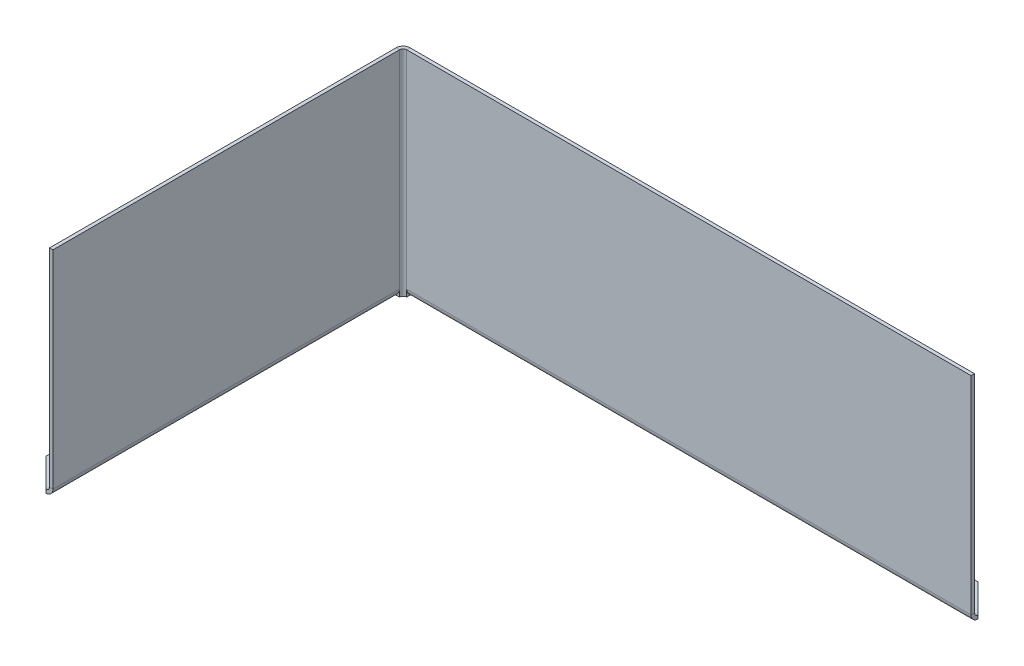
from build123d import *

# Parameters (mm, degrees)
SKETCH1_W                    = 125.73
SKETCH1_H                    = 76.2
BASE_FLANGE1_DEPTH           = 1.2192
EDGE_FLANGE1_STRIP_W         = 7.4168
EDGE_FLANGE1_STRIP_H         = 1.2192
EDGE_FLANGE1_STRIP_CUT_DEPTH = 76.2
EDGE_FLANGE1_DEPTH           = 76.2
EDGE_FLANGE2_STRIP_W         = 7.4168
EDGE_FLANGE2_STRIP_H         = 1.2192
EDGE_FLANGE2_STRIP_CUT_DEPTH = 123.2408
EDGE_FLANGE2_DEPTH           = 123.2408
EDGE_FLANGE3_STRIP_W         = 7.4168
EDGE_FLANGE3_STRIP_H         = 1.2192
EDGE_FLANGE3_STRIP_CUT_DEPTH = 200.7108
EDGE_FLANGE3_DEPTH           = 200.7108
BREAK_CORNER5_START          = -96.12466152
BREAK_CORNER5_OUTLINE_W      = 143.62455456
BREAK_CORNER5_OUTLINE_H      = 4
BREAK_CORNER5_DEPTH          = 7.220125921
BREAK_CORNER5_START_2        = 38.579180296
BREAK_CORNER5_2_OUTLINE_W    = 8.37544544
BREAK_CORNER5_2_OUTLINE_H    = 4
BREAK_CORNER5_2_DEPTH        = 14.440251843
BREAK_CORNER6_START          = -96.12466152
BREAK_CORNER6_OUTLINE_W      = 88.7601302
BREAK_CORNER6_OUTLINE_H      = 4
BREAK_CORNER6_DEPTH          = 7.220125921
BREAK_CORNER6_START_2        = -16.200382042
BREAK_CORNER6_2_OUTLINE_W    = 8.2398698
BREAK_CORNER6_2_OUTLINE_H    = 4
BREAK_CORNER6_2_DEPTH        = 14.440251842


# Read off the part's stored shape, not the designer's step: Break-Corner5, Break-Corner6
# Sheet-metal steps are written as plain solids
with BuildPart() as part:
    # Sketch1 → Base-Flange1 (new body)
    with BuildSketch(Plane(origin=(0, 0, 0), x_dir=(0, 0, -1), z_dir=(1, 0, 0))):
        with Locations((62.865, 38.1)):
            Rectangle(SKETCH1_W, SKETCH1_H)
    extrude(amount=-BASE_FLANGE1_DEPTH)

    # Edge-Flange1 strip (across the edge) → Edge-Flange1 strip cut (cut)
    with BuildSketch(Plane(origin=(0, 0, -125.73), x_dir=(0, 0, 1), z_dir=(0, 1, 0))):
        with Locations((-1.2192, -0.6096)):
            Rectangle(EDGE_FLANGE1_STRIP_W, EDGE_FLANGE1_STRIP_H)
    extrude(amount=EDGE_FLANGE1_STRIP_CUT_DEPTH, mode=Mode.SUBTRACT)

    # Edge-Flange1 section (across the edge) → Edge-Flange1 (add)
    with BuildSketch(Plane(origin=(0, 0, -125.73), x_dir=(0, 0, 1), z_dir=(0, 1, 0))):
        with BuildLine():
            Line((0, 1.27), (0, 201.9808))
            Line((0, 201.9808), (1.2192, 201.9808))
            Line((1.2192, 201.9808), (1.2192, 1.27))
            ThreePointArc((1.2192, 1.27), (1.591174388, 0.371974388), (2.4892, 0))
            Line((2.4892, 0), (2.4892, -1.2192))
            ThreePointArc((2.4892, -1.2192), (0.7290698, -0.4901302), (0, 1.27))
        make_face()
    extrude(amount=EDGE_FLANGE1_DEPTH)

    # Edge-Flange2 strip (across the edge) → Edge-Flange2 strip cut (cut)
    with BuildSketch(Plane(origin=(-1.2192, 0, -123.2408), x_dir=(0, 1, 0), z_dir=(0, 0, 1))):
        with Locations((-1.2192, -0.6096)):
            Rectangle(EDGE_FLANGE2_STRIP_W, EDGE_FLANGE2_STRIP_H)
    extrude(amount=EDGE_FLANGE2_STRIP_CUT_DEPTH, mode=Mode.SUBTRACT)

    # Edge-Flange2 section (across the edge) → Edge-Flange2 (add)
    with BuildSketch(Plane(origin=(-1.2192, 0, -123.2408), x_dir=(0, 1, 0), z_dir=(0, 0, 1))):
        with BuildLine():
            Line((0, 1.27), (0, 11.4808))
            Line((0, 11.4808), (1.2192, 11.4808))
            Line((1.2192, 11.4808), (1.2192, 1.27))
            ThreePointArc((1.2192, 1.27), (1.591174388, 0.371974388), (2.4892, 0))
            Line((2.4892, 0), (2.4892, -1.2192))
            ThreePointArc((2.4892, -1.2192), (0.7290698, -0.4901302), (0, 1.27))
        make_face()
    extrude(amount=EDGE_FLANGE2_DEPTH)

    # Edge-Flange3 strip (across the edge) → Edge-Flange3 strip cut (cut)
    with BuildSketch(Plane(origin=(201.9808, 0, -125.73), x_dir=(0, 1, 0), z_dir=(-1, 0, 0))):
        with Locations((-1.2192, -0.6096)):
            Rectangle(EDGE_FLANGE3_STRIP_W, EDGE_FLANGE3_STRIP_H)
    extrude(amount=EDGE_FLANGE3_STRIP_CUT_DEPTH, mode=Mode.SUBTRACT)

    # Edge-Flange3 section (across the edge) → Edge-Flange3 (add)
    with BuildSketch(Plane(origin=(201.9808, 0, -125.73), x_dir=(0, 1, 0), z_dir=(-1, 0, 0))):
        with BuildLine():
            Line((0, 1.27), (0, 11.4808))
            Line((0, 11.4808), (1.2192, 11.4808))
            Line((1.2192, 11.4808), (1.2192, 1.27))
            ThreePointArc((1.2192, 1.27), (1.591174388, 0.371974388), (2.4892, 0))
            Line((2.4892, 0), (2.4892, -1.2192))
            ThreePointArc((2.4892, -1.2192), (0.7290698, -0.4901302), (0, 1.27))
        make_face()
    extrude(amount=EDGE_FLANGE3_DEPTH)

    # Break-Corner5 outline → Break-Corner5 (cut)
    with BuildSketch(Plane(origin=(0, 0, 0), x_dir=(0.707106781186546, 0, -0.707106781186549), z_dir=(0.707106781186549, 0, 0.707106781186546)).offset(BREAK_CORNER5_START)):
        with Locations((160.81227728, 1)):
            Rectangle(BREAK_CORNER5_OUTLINE_W, BREAK_CORNER5_OUTLINE_H)
    extrude(amount=BREAK_CORNER5_DEPTH, mode=Mode.SUBTRACT)

    # Break-Corner5 2 outline → Break-Corner5 2 (cut)
    with BuildSketch(Plane(origin=(0, 0, 0), x_dir=(0.707106781186546, 0, -0.707106781186549), z_dir=(0.707106781186549, 0, 0.707106781186546)).offset(BREAK_CORNER5_START_2)):
        with Locations((236.81227728, 1)):
            Rectangle(BREAK_CORNER5_2_OUTLINE_W, BREAK_CORNER5_2_OUTLINE_H)
    extrude(amount=BREAK_CORNER5_2_DEPTH, mode=Mode.SUBTRACT)

    # Break-Corner6 outline → Break-Corner6 (cut)
    with BuildSketch(Plane(origin=(0, 0, 0), x_dir=(0.7071067811865471, 0, -0.707106781186548), z_dir=(0.707106781186548, 0, 0.707106781186547)).offset(BREAK_CORNER6_START)):
        with Locations((42.6199349, 1)):
            Rectangle(BREAK_CORNER6_OUTLINE_W, BREAK_CORNER6_OUTLINE_H)
    extrude(amount=BREAK_CORNER6_DEPTH, mode=Mode.SUBTRACT)

    # Break-Corner6 2 outline → Break-Corner6 2 (cut)
    with BuildSketch(Plane(origin=(0, 0, 0), x_dir=(0.7071067811865471, 0, -0.707106781186548), z_dir=(0.707106781186548, 0, 0.707106781186547)).offset(BREAK_CORNER6_START_2)):
        with Locations((-5.8800651, 1)):
            Rectangle(BREAK_CORNER6_2_OUTLINE_W, BREAK_CORNER6_2_OUTLINE_H)
    extrude(amount=BREAK_CORNER6_2_DEPTH, mode=Mode.SUBTRACT)


solid = part.part
